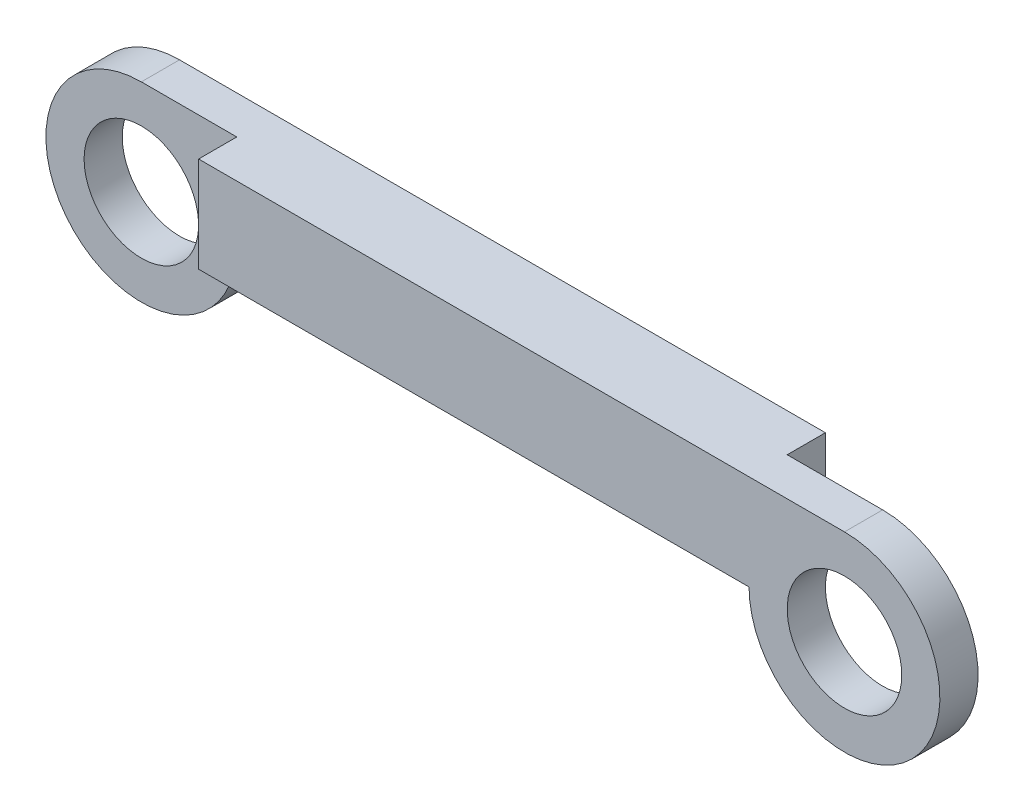
from build123d import *

# Parameters (mm, degrees)
SKETCH1_R           = 15
BOSS_EXTRUDE1_DEPTH = 20
SKETCH2_W           = 50
SKETCH2_H           = 10
CUT_EXTRUDE1_DEPTH  = 84


with BuildPart() as part:
    # Sketch1 → Boss-Extrude1 (new body)
    with BuildSketch(Plane.XY):
        with BuildLine():
            Line((-72.1, -25), (72.1, -25))
            ThreePointArc((72.1, -25), (114.77766953, -42.67766953), (97.1, 0))
            Line((97.1, 0), (-97.1, 0))
            ThreePointArc((-97.1, 0), (-114.77766953, -42.67766953), (-72.1, -25))
        make_face()
        with Locations((-97.1, -25)):
            Circle(SKETCH1_R, mode=Mode.SUBTRACT)
        with Locations((97.1, -25)):
            Circle(SKETCH1_R, mode=Mode.SUBTRACT)
    extrude(amount=BOSS_EXTRUDE1_DEPTH)

    # Sketch2 → Cut-Extrude1 (cut)
    with BuildSketch(Plane(origin=(0, 0, 0), x_dir=(1, 0, 0), z_dir=(0, 1, 0))):
        with Locations((97.1, -5)):
            Rectangle(SKETCH2_W, SKETCH2_H)
        with Locations((-97.1, -15)):
            Rectangle(SKETCH2_W, SKETCH2_H)
    extrude(amount=-CUT_EXTRUDE1_DEPTH, mode=Mode.SUBTRACT)


solid = part.part
